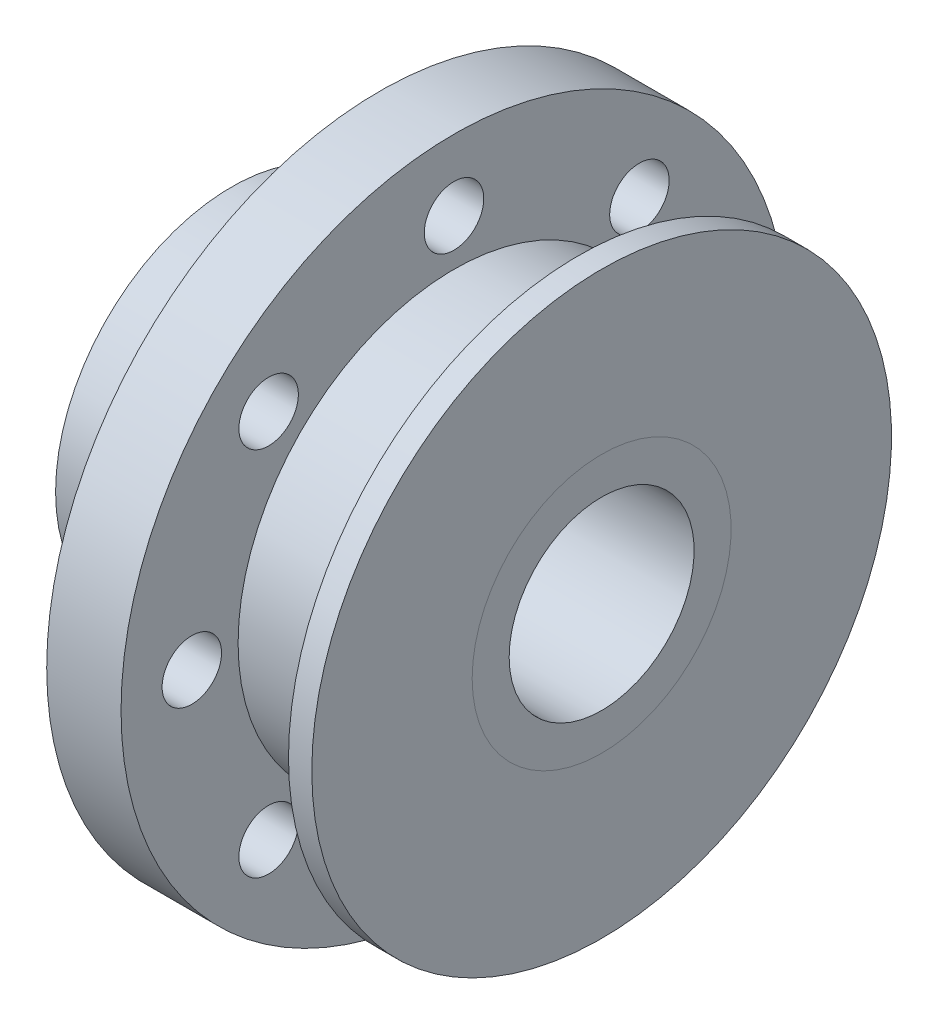
from build123d import *

# Parameters (mm, degrees)
F_1_4_20_TAPPED_HOLE1_D     = 5.1054
F_1_4_20_TAPPED_HOLE1_DEPTH = 10.16
F_1_4_20_TAPPED_HOLE1_TIP   = 1.533816902
SKETCH5_W                   = 12.7
SKETCH5_H                   = 3.175


with BuildPart() as part:
    # Sketch1 → Revolve1 (revolve)
    with BuildSketch(Plane.XY):
        Polygon((-12.7, 15.112500017), (0, 15.112500017), (0, 28.575), (6.37999994, 28.575), (6.37999994, 24.875000034), (6.37999994, 18.52951598), (17.04999994, 18.52951598), (17.04999994, 24.875000034), (19.05, 24.875000034), (19.05, 11.1125), (6.35, 11.1125), (6.35, 8.9375), (0, 8.9375), (0, 11.1125), (-12.7, 11.1125), align=None)
    revolve(axis=Axis((0, 0, 0), (1, 0, 0)))

    # 1/4-20 Tapped Hole1
    with Locations(Plane.ZY):
        with Locations((-15.909902577, -15.909902577), (-22.5, 0), (-15.909902577, 15.909902577), (0, 22.5), (15.909902577, 15.909902577), (22.5, 0), (15.909902577, -15.909902577), (0, -22.5)):
            Hole(F_1_4_20_TAPPED_HOLE1_D / 2, depth=F_1_4_20_TAPPED_HOLE1_DEPTH)
            with Locations((0, 0, -(F_1_4_20_TAPPED_HOLE1_DEPTH + F_1_4_20_TAPPED_HOLE1_TIP / 2))):  # 118° drill point
                Cone(0, F_1_4_20_TAPPED_HOLE1_D / 2, F_1_4_20_TAPPED_HOLE1_TIP, mode=Mode.SUBTRACT)


with BuildPart() as body_2:
    # Sketch5 → Revolve2 (revolve)
    with BuildSketch(Plane.XY):
        with Locations((12.7, 9.525)):
            Rectangle(SKETCH5_W, SKETCH5_H)
        with Locations((-6.35, 9.525)):
            Rectangle(SKETCH5_W, SKETCH5_H)
    revolve(axis=Axis((0, 0, 0), (1, 0, 0)))


solid = Compound([part.part, body_2.part])
